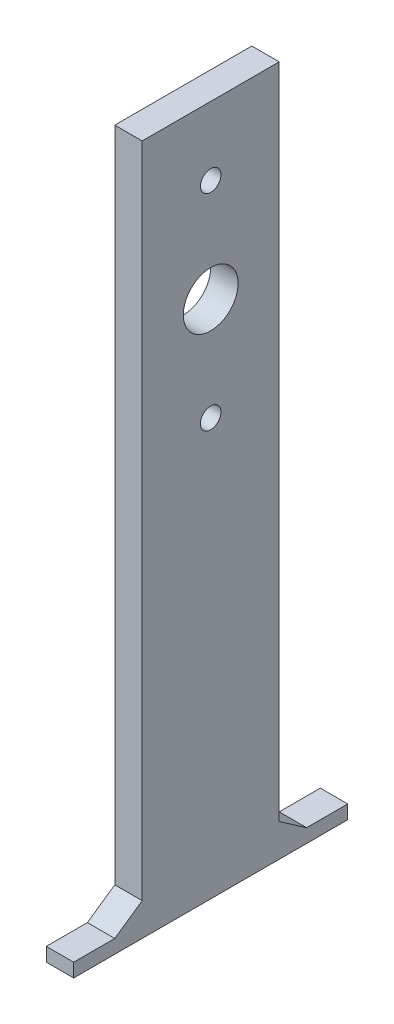
from build123d import *

# Parameters (mm, degrees)
BOSS_EXTRUDE1_DEPTH = 252
CUT_EXTRUDE2_DEPTH  = 10
SKETCH4_W           = 25
SKETCH4_H           = 52
CUT_EXTRUDE3_DEPTH  = 10
SKETCH5_R           = 3.75
SKETCH5_R_2         = 10
CUT_EXTRUDE5_DEPTH  = 264.114043715


with BuildPart() as part:
    # Sketch1 → Boss-Extrude1 (new body)
    with BuildSketch(Plane(origin=(0, 0, 0), x_dir=(1, 0, 0), z_dir=(0, 1, 0))):
        Polygon((10, 0), (10, 50), (10, 75), (0, 75), (0, 50), (0, 0), (0, -25), (10, -25), align=None)
    extrude(amount=BOSS_EXTRUDE1_DEPTH)

    # Sketch3 → Cut-Extrude2 (cut)
    with BuildSketch(Plane.ZY):
        Polygon((25, 200), (25, 5), (10, 5), (0, 11.937821542), (0, 200), align=None)
        Polygon((-75, 5), (-60, 5), (-50, 11.937821542), (-50, 252), (-75, 252), align=None)
    extrude(amount=-CUT_EXTRUDE2_DEPTH, mode=Mode.SUBTRACT)

    # Sketch4 → Cut-Extrude3 (cut)
    with BuildSketch(Plane(origin=(10, 0, 0), x_dir=(0, 0, -1), z_dir=(1, 0, 0))):
        with Locations((-12.5, 226)):
            Rectangle(SKETCH4_W, SKETCH4_H)
    extrude(amount=-CUT_EXTRUDE3_DEPTH, mode=Mode.SUBTRACT)

    # Sketch5 → Cut-Extrude5 (cut, through all)
    with BuildSketch(Plane(origin=(10, 0, 0), x_dir=(0, 0, -1), z_dir=(1, 0, 0))):
        with Locations((25, 227)):
            Circle(SKETCH5_R)
        with Locations((25, 189.5)):
            Circle(SKETCH5_R_2)
        with Locations((25, 152)):
            Circle(SKETCH5_R)
    extrude(amount=-CUT_EXTRUDE5_DEPTH, mode=Mode.SUBTRACT)


solid = part.part
